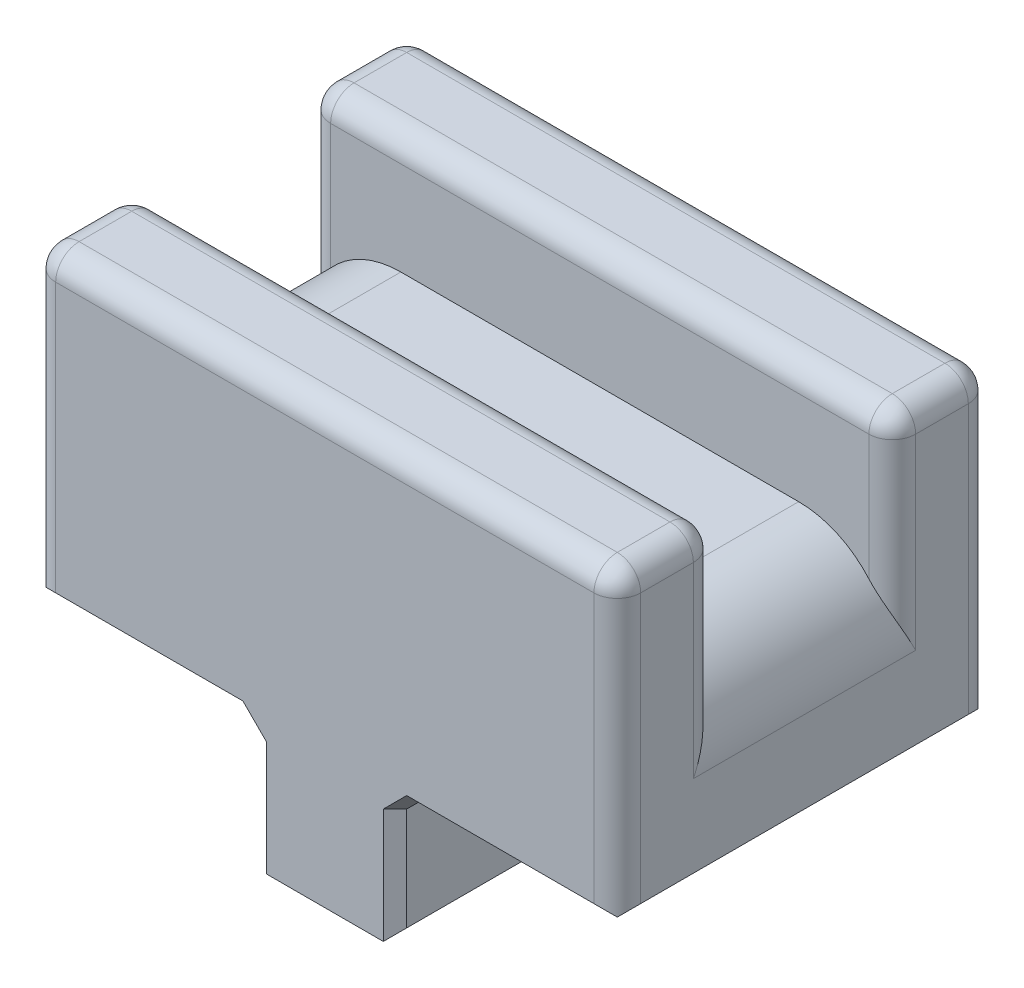
from build123d import *

# Parameters (mm, degrees)
SKIZZE1_W                       = 25
SKIZZE1_H                       = 16
AUFSATZ_LINEAR_AUSTRAGEN1_DEPTH = 13
SKIZZE2_W                       = 25
SKIZZE2_H                       = 7.5
SCHNITT_LINEAR_AUSTRAGEN1_DEPTH = 5
SKIZZE3_W                       = 6
SKIZZE3_H                       = 16
AUFSATZ_LINEAR_AUSTRAGEN2_DEPTH = 5.4
VERRUNDUNG1_R                   = 1
FASE1_SIZE                      = 0.5
VERRUNDUNG2_R                   = 4
VERRUNDUNG3_R                   = 1


with BuildPart() as part:
    # Skizze1 → Aufsatz-Linear austragen1 (new body)
    with BuildSketch(Plane(origin=(0, 0, 0), x_dir=(1, 0, 0), z_dir=(0, 1, 0))):
        Rectangle(SKIZZE1_W, SKIZZE1_H)
    extrude(amount=AUFSATZ_LINEAR_AUSTRAGEN1_DEPTH)

    # Skizze2 → Schnitt-Linear austragen1 (cut)
    with BuildSketch(Plane(origin=(0, 13, 0), x_dir=(1, 0, 0), z_dir=(0, 1, 0))):
        Rectangle(SKIZZE2_W, SKIZZE2_H)
    extrude(amount=-SCHNITT_LINEAR_AUSTRAGEN1_DEPTH, mode=Mode.SUBTRACT)

    # Skizze3 → Aufsatz-Linear austragen2 (add)
    with BuildSketch(Plane.XZ):
        Rectangle(SKIZZE3_W, SKIZZE3_H)
    extrude(amount=AUFSATZ_LINEAR_AUSTRAGEN2_DEPTH)

    # Verrundung1
    verrundung1_edges = [part.edges().sort_by_distance(p)[0] for p in [
        (12.5, 10.5, -3.75),
        (12.5, 10.5, 3.75),
        (-12.5, 10.5, 3.75),
        (-12.5, 10.5, -3.75),
        (0, 13, -3.75),
        (0, 13, 3.75),
    ]]
    fillet(verrundung1_edges, radius=VERRUNDUNG1_R)

    # Fase1
    fase1_edges = [part.edges().sort_by_distance(p)[0] for p in [
        (7.75, 0, 8),
        (-7.75, 0, -8),
        (3, 0, 0),
        (3, -2.7, -8),
        (3, -2.7, 8),
        (-3, 0, 0),
        (-3, -2.7, 8),
        (-3, -2.7, -8),
        (3, -5.4, 0),
        (-3, -5.4, 0),
        (-7.75, 0, 8),
        (-12.5, 0, 0),
        (7.75, 0, -8),
        (12.5, 0, 0),
    ]]
    chamfer(fase1_edges, length=FASE1_SIZE)

    # Verrundung2
    verrundung2_edges = [part.edges().sort_by_distance(p)[0] for p in [
        (12.5, 8, 0),
        (-12.5, 8, 0),
    ]]
    fillet(verrundung2_edges, radius=VERRUNDUNG2_R)

    # Verrundung3
    # the kernel refuses this fillet: 1 mm, written as the material it takes off along each edge
    with BuildSketch(Plane(origin=(-11.5, 12, 4.75), x_dir=(0, 1, 0), z_dir=(-1, 0, 0))) as verrundung3_piece_1_section:
        Polygon((0, 0), (VERRUNDUNG3_R, 0), (VERRUNDUNG3_R, VERRUNDUNG3_R), (0, VERRUNDUNG3_R), align=None)
    verrundung3_piece_1 = extrude(amount=VERRUNDUNG3_R, mode=Mode.PRIVATE)
    verrundung3_piece_1 = verrundung3_piece_1 - Plane(origin=(-11.5, 12, 4.75), x_dir=(0, -0.7071067811865475, 0.7071067811865475), z_dir=(-1, 0, 0)) * Sphere(VERRUNDUNG3_R, mode=Mode.PRIVATE)
    add(verrundung3_piece_1, mode=Mode.SUBTRACT)
    with BuildSketch(Plane(origin=(11.5, 12, 4.75), x_dir=(1, 0, 0), z_dir=(0, 1, 0))) as verrundung3_piece_2_section:
        Polygon((0, 0), (VERRUNDUNG3_R, 0), (VERRUNDUNG3_R, VERRUNDUNG3_R), (0, VERRUNDUNG3_R), align=None)
    verrundung3_piece_2 = extrude(amount=VERRUNDUNG3_R, mode=Mode.PRIVATE)
    verrundung3_piece_2 = verrundung3_piece_2 - Plane(origin=(11.5, 12, 4.75), x_dir=(-0.7071067811865475, 0, 0.7071067811865475), z_dir=(0, 1, 0)) * Sphere(VERRUNDUNG3_R, mode=Mode.PRIVATE)
    add(verrundung3_piece_2, mode=Mode.SUBTRACT)
    with BuildSketch(Plane(origin=(-11.5, 12, -4.75), x_dir=(0, 1, 0), z_dir=(-1, 0, 0))) as verrundung3_piece_3_section:
        Polygon((0, 0), (VERRUNDUNG3_R, 0), (VERRUNDUNG3_R, -VERRUNDUNG3_R), (0, -VERRUNDUNG3_R), align=None)
    verrundung3_piece_3 = extrude(amount=VERRUNDUNG3_R, mode=Mode.PRIVATE)
    verrundung3_piece_3 = verrundung3_piece_3 - Plane(origin=(-11.5, 12, -4.75), x_dir=(0, -0.7071067811865475, -0.7071067811865475), z_dir=(-1, 0, 0)) * Sphere(VERRUNDUNG3_R, mode=Mode.PRIVATE)
    add(verrundung3_piece_3, mode=Mode.SUBTRACT)
    with BuildSketch(Plane(origin=(11.5, 12, -4.75), x_dir=(1, 0, 0), z_dir=(0, 1, 0))) as verrundung3_piece_4_section:
        Polygon((0, 0), (VERRUNDUNG3_R, 0), (VERRUNDUNG3_R, -VERRUNDUNG3_R), (0, -VERRUNDUNG3_R), align=None)
    verrundung3_piece_4 = extrude(amount=VERRUNDUNG3_R, mode=Mode.PRIVATE)
    verrundung3_piece_4 = verrundung3_piece_4 - Plane(origin=(11.5, 12, -4.75), x_dir=(-0.7071067811865475, 0, -0.7071067811865475), z_dir=(0, 1, 0)) * Sphere(VERRUNDUNG3_R, mode=Mode.PRIVATE)
    add(verrundung3_piece_4, mode=Mode.SUBTRACT)
    with BuildSketch(Plane(origin=(-11.5, 12, -7), x_dir=(0, 0, -1), z_dir=(-1, 0, 0))) as verrundung3_piece_5_section:
        Polygon((0, 0), (VERRUNDUNG3_R, 0), (VERRUNDUNG3_R, -VERRUNDUNG3_R), (0, -VERRUNDUNG3_R), align=None)
    verrundung3_piece_5 = extrude(amount=VERRUNDUNG3_R, mode=Mode.PRIVATE)
    verrundung3_piece_5 = verrundung3_piece_5 - Plane(origin=(-11.5, 12, -7), x_dir=(0, -0.7071067811865475, 0.7071067811865475), z_dir=(-1, 0, 0)) * Sphere(VERRUNDUNG3_R, mode=Mode.PRIVATE)
    add(verrundung3_piece_5, mode=Mode.SUBTRACT)
    with BuildSketch(Plane(origin=(-11.5, 12, 7), x_dir=(0, 1, 0), z_dir=(-1, 0, 0))) as verrundung3_piece_6_section:
        Polygon((0, 0), (VERRUNDUNG3_R, 0), (VERRUNDUNG3_R, -VERRUNDUNG3_R), (0, -VERRUNDUNG3_R), align=None)
    verrundung3_piece_6 = extrude(amount=VERRUNDUNG3_R, mode=Mode.PRIVATE)
    verrundung3_piece_6 = verrundung3_piece_6 - Plane(origin=(-11.5, 12, 7), x_dir=(0, -0.7071067811865475, -0.7071067811865475), z_dir=(-1, 0, 0)) * Sphere(VERRUNDUNG3_R, mode=Mode.PRIVATE)
    add(verrundung3_piece_6, mode=Mode.SUBTRACT)
    with BuildSketch(Plane(origin=(11.5, 12, 7), x_dir=(0, 1, 0), z_dir=(1, 0, 0))) as verrundung3_piece_7_section:
        Polygon((0, 0), (VERRUNDUNG3_R, 0), (VERRUNDUNG3_R, VERRUNDUNG3_R), (0, VERRUNDUNG3_R), align=None)
    verrundung3_piece_7 = extrude(amount=VERRUNDUNG3_R, mode=Mode.PRIVATE)
    verrundung3_piece_7 = verrundung3_piece_7 - Plane(origin=(11.5, 12, 7), x_dir=(0, -0.7071067811865475, -0.7071067811865475), z_dir=(1, 0, 0)) * Sphere(VERRUNDUNG3_R, mode=Mode.PRIVATE)
    add(verrundung3_piece_7, mode=Mode.SUBTRACT)
    with BuildSketch(Plane(origin=(11.5, 12, -7), x_dir=(1, 0, 0), z_dir=(0, 0, -1))) as verrundung3_piece_8_section:
        Polygon((0, 0), (VERRUNDUNG3_R, 0), (VERRUNDUNG3_R, -VERRUNDUNG3_R), (0, -VERRUNDUNG3_R), align=None)
    verrundung3_piece_8 = extrude(amount=VERRUNDUNG3_R, mode=Mode.PRIVATE)
    verrundung3_piece_8 = verrundung3_piece_8 - Plane(origin=(11.5, 12, -7), x_dir=(-0.7071067811865475, -0.7071067811865475, 0), z_dir=(0, 0, -1)) * Sphere(VERRUNDUNG3_R, mode=Mode.PRIVATE)
    add(verrundung3_piece_8, mode=Mode.SUBTRACT)
    with BuildSketch(Plane(origin=(-12.5, 13, -7), x_dir=(0, -1, 0), z_dir=(0, 0, 1)), Plane(origin=(-12.5, 13, 4.75), x_dir=(0, -1, 0), z_dir=(0, 0, 1))) as verrundung3_piece_9:
        with BuildLine():
            CenterArc((VERRUNDUNG3_R, VERRUNDUNG3_R), VERRUNDUNG3_R, 180, 90)
            Line((0, VERRUNDUNG3_R), (0, 0))
            Line((0, 0), (VERRUNDUNG3_R, 0))
        make_face()
    extrude(amount=2.25, mode=Mode.SUBTRACT)
    with BuildSketch(Plane(origin=(-11.5, 13, 8), x_dir=(0, 0, -1), z_dir=(1, 0, 0)), Plane(origin=(11.5, 13, -8), x_dir=(0, 0, 1), z_dir=(-1, 0, 0))) as verrundung3_piece_10:
        with BuildLine():
            CenterArc((VERRUNDUNG3_R, -VERRUNDUNG3_R), VERRUNDUNG3_R, 90, 90)
            Line((0, -VERRUNDUNG3_R), (0, 0))
            Line((0, 0), (VERRUNDUNG3_R, 0))
        make_face()
    extrude(amount=23, mode=Mode.SUBTRACT)
    with BuildSketch(Plane(origin=(12.5, 13, 7), x_dir=(-1, 0, 0), z_dir=(0, 0, -1)), Plane(origin=(12.5, 13, -4.75), x_dir=(-1, 0, 0), z_dir=(0, 0, -1))) as verrundung3_piece_11:
        with BuildLine():
            CenterArc((VERRUNDUNG3_R, -VERRUNDUNG3_R), VERRUNDUNG3_R, 90, 90)
            Line((0, -VERRUNDUNG3_R), (0, 0))
            Line((0, 0), (VERRUNDUNG3_R, 0))
        make_face()
    extrude(amount=2.25, mode=Mode.SUBTRACT)
    with BuildSketch(Plane(origin=(12.5, -2, 8), x_dir=(-1, 0, 0), z_dir=(0, 1, 0)), Plane(origin=(-12.5, -2, 8), x_dir=(0, 0, -1), z_dir=(0, 1, 0))) as verrundung3_piece_12:
        with BuildLine():
            CenterArc((VERRUNDUNG3_R, -VERRUNDUNG3_R), VERRUNDUNG3_R, 90, 90)
            Line((0, -VERRUNDUNG3_R), (0, 0))
            Line((0, 0), (VERRUNDUNG3_R, 0))
        make_face()
    extrude(amount=14, mode=Mode.SUBTRACT)
    with BuildSketch(Plane(origin=(-12.5, -2, -8), x_dir=(0, 0, 1), z_dir=(0, 1, 0)), Plane(origin=(12.5, -2, -8), x_dir=(-1, 0, 0), z_dir=(0, 1, 0))) as verrundung3_piece_13:
        with BuildLine():
            CenterArc((VERRUNDUNG3_R, VERRUNDUNG3_R), VERRUNDUNG3_R, 180, 90)
            Line((0, VERRUNDUNG3_R), (0, 0))
            Line((0, 0), (VERRUNDUNG3_R, 0))
        make_face()
    extrude(amount=14, mode=Mode.SUBTRACT)


solid = part.part
